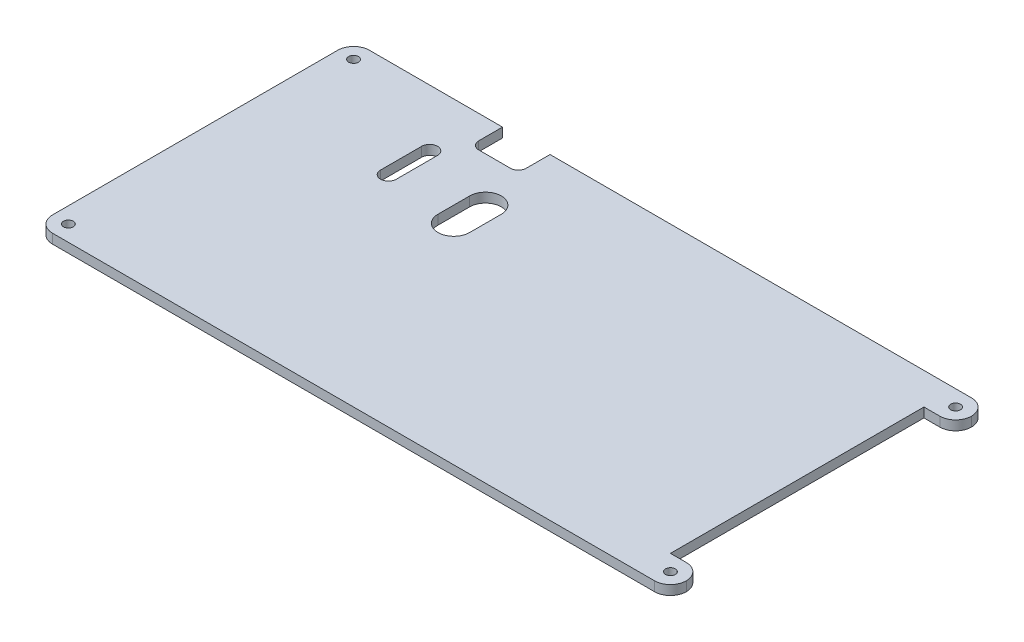
from build123d import *

# Parameters (mm, degrees)
SKETCH1_W           = 200
SKETCH1_H           = 100
BOSS_EXTRUDE1_DEPTH = 3
SKETCH2_R           = 1.55
CUT_EXTRUDE1_DEPTH  = 112.843640856
FILLET1_R           = 5
SKETCH3_W           = 10
SKETCH3_H           = 80
SKETCH3_W_2         = 15
SKETCH3_H_2         = 10
CUT_EXTRUDE2_DEPTH  = 112.843640856
FILLET2_R           = 5
FILLET4_R           = 2.5


with BuildPart() as part:
    # Sketch1 → Boss-Extrude1 (new body)
    with BuildSketch(Plane(origin=(0, 0, 0), x_dir=(1, 0, 0), z_dir=(0, 1, 0))):
        Rectangle(SKETCH1_W, SKETCH1_H)
    extrude(amount=BOSS_EXTRUDE1_DEPTH)

    # Sketch2 → Cut-Extrude1 (cut, through all)
    with BuildSketch(Plane(origin=(0, 3, 0), x_dir=(1, 0, 0), z_dir=(0, 1, 0))):
        with Locations(Location((-95, 45, 0), (0, 0, 270))):
            Circle(SKETCH2_R)
        with Locations(Location((-95, -45, 0), (0, 0, 270))):
            Circle(SKETCH2_R)
        with Locations(Location((95, 45, 0), (0, 0, 270))):
            Circle(SKETCH2_R)
        with Locations(Location((95, -45, 0), (0, 0, 270))):
            Circle(SKETCH2_R)
    extrude(amount=-CUT_EXTRUDE1_DEPTH, mode=Mode.SUBTRACT)

    # Fillet1
    fillet1_edges = [part.edges().sort_by_distance(p)[0] for p in [
        (-100, 1.5, -50),
        (100, 1.5, -50),
        (100, 1.5, 50),
        (-100, 1.5, 50),
    ]]
    fillet(fillet1_edges, radius=FILLET1_R)

    # Sketch3 → Cut-Extrude2 (cut, through all)
    with BuildSketch(Plane(origin=(0, 3, 0), x_dir=(1, 0, 0), z_dir=(0, 1, 0))):
        with Locations((95, 0)):
            Rectangle(SKETCH3_W, SKETCH3_H)
        with BuildLine():
            Line((-55.5, 32), (-55.5, 19))
            ThreePointArc((-55.5, 19), (-58, 16.5), (-60.5, 19))
            Line((-60.5, 19), (-60.5, 32))
            ThreePointArc((-60.5, 32), (-58, 34.5), (-55.5, 32))
        make_face()
        with BuildLine():
            Line((-29.365, 26), (-29.365, 16))
            ThreePointArc((-29.365, 16), (-34.365, 11), (-39.365, 16))
            Line((-39.365, 16), (-39.365, 26))
            ThreePointArc((-39.365, 26), (-34.365, 31), (-29.365, 26))
        make_face()
        with Locations((-45.5, 45)):
            Rectangle(SKETCH3_W_2, SKETCH3_H_2)
    extrude(amount=-CUT_EXTRUDE2_DEPTH, mode=Mode.SUBTRACT)

    # Fillet2
    fillet2_edges = [part.edges().sort_by_distance(p)[0] for p in [
        (100, 1.5, 40),
        (100, 1.5, -40),
    ]]
    fillet(fillet2_edges, radius=FILLET2_R - 0.0001)  # a hair under: the kernel refuses the full size

    # Fillet4
    fillet4_edges = [part.edges().sort_by_distance(p)[0] for p in [
        (-38, 1.5, -40),
        (-53, 1.5, -40),
    ]]
    fillet(fillet4_edges, radius=FILLET4_R)


solid = part.part
